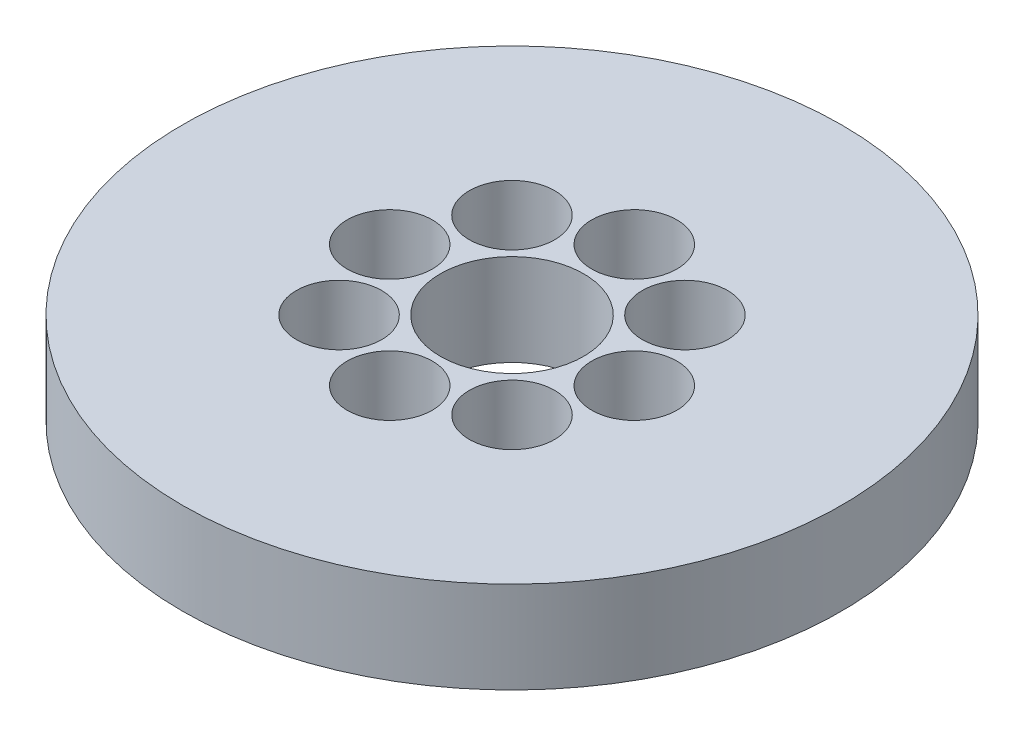
from build123d import *

# Parameters (mm, degrees)
SKETCH1_R           = 57.5
BOSS_EXTRUDE1_DEPTH = 16
SKETCH2_R           = 12.5
CUT_EXTRUDE1_DEPTH  = 83.876414015
SKETCH3_R           = 7.439291055
CUT_EXTRUDE2_DEPTH  = 12.432982932
CIRPATTERN1_COUNT   = 8


with BuildPart() as part:
    # Sketch1 → Boss-Extrude1 (new body)
    with BuildSketch(Plane(origin=(0, 0, 0), x_dir=(1, 0, 0), z_dir=(0, 1, 0))):
        Circle(SKETCH1_R)
    extrude(amount=BOSS_EXTRUDE1_DEPTH)

    # Sketch2 → Cut-Extrude1 (cut, through all)
    with BuildSketch(Plane(origin=(0, 0, 0), x_dir=(1, 0, 0), z_dir=(0, 1, 0))):
        Circle(SKETCH2_R)
    extrude(amount=CUT_EXTRUDE1_DEPTH, mode=Mode.SUBTRACT)

    # Sketch3 → Cut-Extrude2 (cut)
    with BuildSketch(Plane(origin=(0, 16, 0), x_dir=(1, 0, 0), z_dir=(0, 1, 0))):
        with Locations((-21.336549902, 0)):
            Circle(SKETCH3_R)
    cut_extrude2 = extrude(amount=-CUT_EXTRUDE2_DEPTH, mode=Mode.SUBTRACT)

    # CirPattern1: Cut-Extrude2 ×8 about axis
    cirpattern1_axis = Axis((0, 0, 0), (0, 1, 0))
    for i in range(1, CIRPATTERN1_COUNT):
        add(cut_extrude2.rotate(cirpattern1_axis, i * 360 / CIRPATTERN1_COUNT), mode=Mode.SUBTRACT)


solid = part.part
